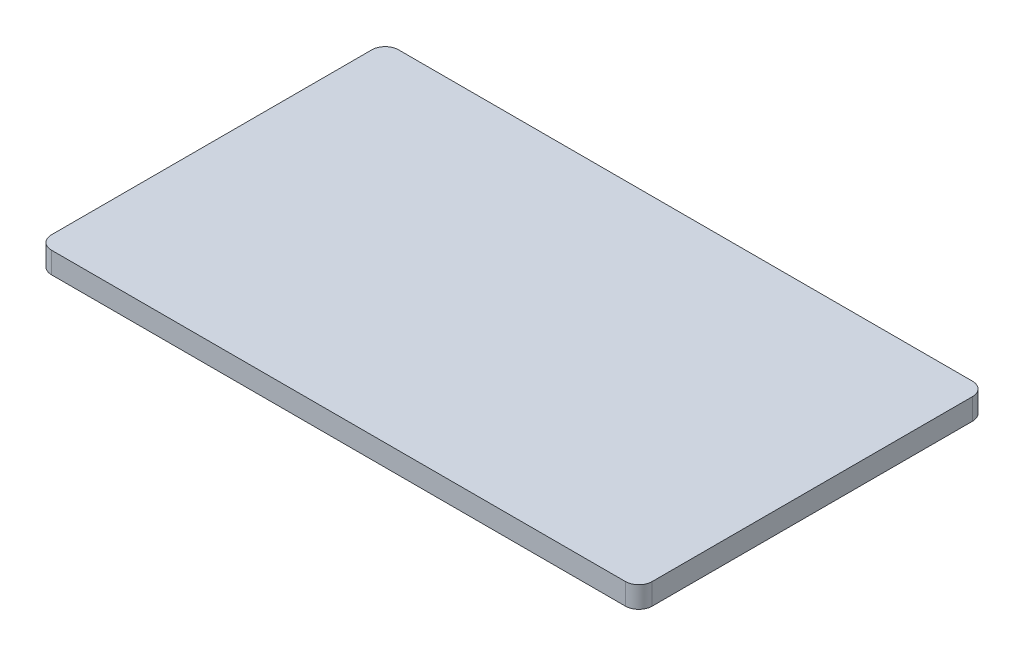
from build123d import *

# Parameters (mm, degrees)
SKETCH1_W           = 45
SKETCH1_H           = 26
BOSS_EXTRUDE1_DEPTH = 1.6
FILLET1_R           = 1


with BuildPart() as part:
    # Sketch1 → Boss-Extrude1 (new body)
    with BuildSketch(Plane(origin=(0, 0, 0), x_dir=(1, 0, 0), z_dir=(0, 1, 0))):
        Rectangle(SKETCH1_W, SKETCH1_H)
    extrude(amount=BOSS_EXTRUDE1_DEPTH)

    # Fillet1
    fillet1_edges = [part.edges().sort_by_distance(p)[0] for p in [
        (22.5, 0.8, 13),
        (22.5, 0.8, -13),
        (-22.5, 0.8, -13),
        (-22.5, 0.8, 13),
    ]]
    fillet(fillet1_edges, radius=FILLET1_R)


solid = part.part
